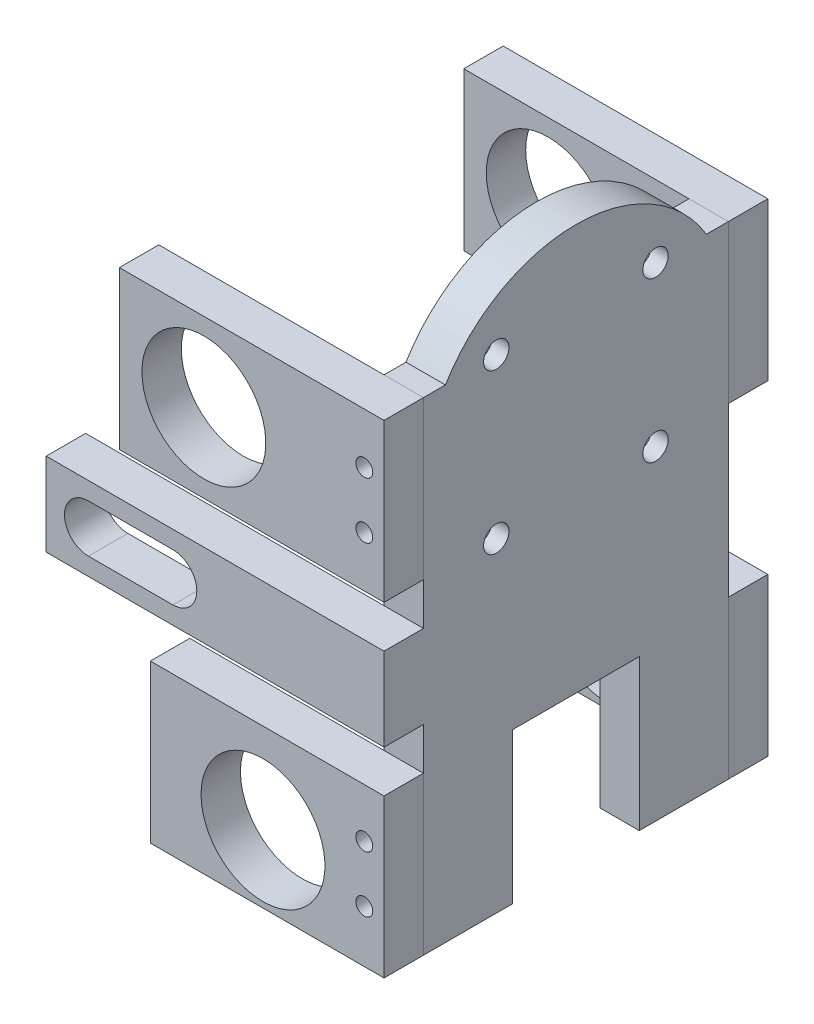
from build123d import *

# Parameters (mm, degrees)
BOSS_EXTRUDE1_DEPTH            = 3.5
BOSS_EXTRUDE1_DEPTH_BACK       = 3.5
BOSS_EXTRUDE2_DEPTH            = 3.5
BOSS_EXTRUDE2_DEPTH_BACK       = 3.5
SKETCH3_W                      = 68.16
SKETCH3_H                      = 28
CBORE_FOR_M4_SHCS1_D           = 4.5
CBORE_FOR_M4_SHCS1_CBORE_D     = 8
CBORE_FOR_M4_SHCS1_CBORE_DEPTH = 4
SKETCH5_W                      = 7
SKETCH5_H                      = 28
BOSS_EXTRUDE4_DEPTH            = 40
SKETCH6_R                      = 11
CUT_EXTRUDE2_DEPTH             = 101.687812569
SKETCH7_W                      = 22.5
SKETCH7_H                      = 15
CUT_EXTRUDE3_DEPTH             = 80.758676017
SKETCH8_W                      = 41.5
SKETCH8_H                      = 28
BOSS_EXTRUDE5_DEPTH            = 7
CUT_EXTRUDE4_DEPTH             = 104.844732654
CUT_EXTRUDE4_DEPTH_BACK        = 104.844732654
SKETCH9_R                      = 11
SKETCH17_W                     = 7
SKETCH17_H                     = 15.83
BOSS_EXTRUDE8_DEPTH            = 11.77
SKETCH13_W                     = 60
SKETCH13_H                     = 14.77
BOSS_EXTRUDE7_DEPTH            = 7
CUT_EXTRUDE5_REACH             = 115.969
SKETCH16_R                     = 1.5
CUT_EXTRUDE6_DEPTH             = 7.5
SPLIT1_START                   = 27.08
SPLIT1_OUTLINE_W               = 41.5
SPLIT1_OUTLINE_H               = 28
SPLIT1_OUTLINE_R               = 11
SPLIT1_OUTLINE_R_2             = 1.5
SPLIT1_DEPTH                   = 7
SPLIT1_2_OUTLINE_W             = 47
SPLIT1_2_OUTLINE_H             = 28
SPLIT1_2_OUTLINE_R             = 1.5
SPLIT1_2_OUTLINE_R_2           = 11
SPLIT1_2_DEPTH                 = 7
SPLIT1_3_OUTLINE_W             = 41.5
SPLIT1_3_OUTLINE_H             = 28
SPLIT1_3_OUTLINE_R             = 11
SPLIT1_3_OUTLINE_R_2           = 1.5
SPLIT1_3_OUTLINE_W_2           = 47
SPLIT1_3_DEPTH                 = 7


# Read off the part's stored shape, not the designer's step: Split1
with BuildPart() as part:
    # Sketch1 → Boss-Extrude1 (new, two sides: drawn at the far end of the back side and taken through both)
    with BuildSketch(Plane(origin=(0, 0, 0), x_dir=(0, 0, -1), z_dir=(1, 0, 0)).offset(-BOSS_EXTRUDE1_DEPTH_BACK)):
        with BuildLine():
            Line((-27.08, 0), (-27.08, -60))
            Line((-27.08, -60), (27.08, -60))
            Line((27.08, -60), (27.08, 0))
            ThreePointArc((27.08, 0), (0, 27.08), (-27.08, 0))
        make_face()
    extrude(amount=BOSS_EXTRUDE1_DEPTH + BOSS_EXTRUDE1_DEPTH_BACK)

    # Sketch3 → Boss-Extrude2 (add, two sides: drawn at the far end of the back side and taken through both)
    with BuildSketch(Plane(origin=(0, 0, 0), x_dir=(0, 0, -1), z_dir=(1, 0, 0)).offset(-BOSS_EXTRUDE2_DEPTH_BACK)):
        Rectangle(SKETCH3_W, SKETCH3_H)
    extrude(amount=BOSS_EXTRUDE2_DEPTH + BOSS_EXTRUDE2_DEPTH_BACK)

    # CBORE for M4 SHCS1 (through all)
    with Locations(Plane(origin=(-3.5, 0, 0), x_dir=(0, 0, -1), z_dir=(-1, 0, 0))):
        with Locations((-14.142135624, -14.142135624), (-14.142135624, 14.142135624), (14.142135624, 14.142135624), (14.142135624, -14.142135624)):
            CounterBoreHole(CBORE_FOR_M4_SHCS1_D / 2, CBORE_FOR_M4_SHCS1_CBORE_D / 2, CBORE_FOR_M4_SHCS1_CBORE_DEPTH)

    # Sketch5 → Boss-Extrude4 (add)
    with BuildSketch(Plane.ZY.offset(3.5)):
        with Locations((-30.58, 0)):
            Rectangle(SKETCH5_W, SKETCH5_H)
        with Locations((30.58, 0)):
            Rectangle(SKETCH5_W, SKETCH5_H)
    extrude(amount=BOSS_EXTRUDE4_DEPTH)

    # Sketch6 → Cut-Extrude2 (cut, through all)
    with BuildSketch(Plane(origin=(0, 0, -34.08), x_dir=(-1, 0, 0), z_dir=(0, 0, -1))):
        with Locations((28.5, 0)):
            Circle(SKETCH6_R)
    extrude(amount=-CUT_EXTRUDE2_DEPTH, mode=Mode.SUBTRACT)

    # Sketch7 → Cut-Extrude3 (cut, through all)
    with BuildSketch(Plane.ZY.offset(3.5)):
        with Locations((0, -52.5)):
            Rectangle(SKETCH7_W, SKETCH7_H)
    extrude(amount=-CUT_EXTRUDE3_DEPTH, mode=Mode.SUBTRACT)

    # Sketch8 → Boss-Extrude5 (add)
    with BuildSketch(Plane.XY.offset(27.08)):
        with Locations((-17.25, -57.77)):
            Rectangle(SKETCH8_W, SKETCH8_H)
    boss_extrude5 = extrude(amount=BOSS_EXTRUDE5_DEPTH)

    # Mirror1: Boss-Extrude5 across plane
    add(boss_extrude5.mirror(Plane.XY))

    # Sketch9 → Cut-Extrude4 (cut, two sides: drawn at the far end of the back side and taken through both)
    with BuildSketch(Plane(origin=(0, 0, 27.08), x_dir=(-1, 0, 0), z_dir=(0, 0, -1)).offset(-CUT_EXTRUDE4_DEPTH_BACK)):
        with Locations((18, -59.77)):
            Circle(SKETCH9_R)
    extrude(amount=CUT_EXTRUDE4_DEPTH + CUT_EXTRUDE4_DEPTH_BACK, mode=Mode.SUBTRACT)

    # Sketch17 → Boss-Extrude8 (add)
    with BuildSketch(Plane.XZ.offset(60)):
        with Locations((0, 19.165)):
            Rectangle(SKETCH17_W, SKETCH17_H)
        with Locations((0, -19.165)):
            Rectangle(SKETCH17_W, SKETCH17_H)
    extrude(amount=BOSS_EXTRUDE8_DEPTH)

    # Sketch13 → Boss-Extrude7 (add)
    with BuildSketch(Plane.XY.offset(27.08)):
        with Locations((-26.5, -28.885)):
            Rectangle(SKETCH13_W, SKETCH13_H)
    extrude(amount=BOSS_EXTRUDE7_DEPTH)

    # Sketch15 → Cut-Extrude5 (cut, up to next)
    with BuildSketch(Plane.XY.offset(34.08), mode=Mode.PRIVATE) as cut_extrude5_sk1:
        with BuildLine():
            Line((-34, -33.135), (-49, -33.135))
            ThreePointArc((-49, -33.135), (-53.25, -28.885), (-49, -24.635))
            Line((-49, -24.635), (-34, -24.635))
            ThreePointArc((-34, -24.635), (-29.75, -28.885), (-34, -33.135))
        make_face()
    cut_extrude5_tool1 = extrude(cut_extrude5_sk1.sketch, amount=-CUT_EXTRUDE5_REACH, mode=Mode.PRIVATE) & part.part
    add(cut_extrude5_tool1.solids().sort_by_distance((-41.5, -28.885, 34.08))[0], mode=Mode.SUBTRACT)

    # Sketch16 → Cut-Extrude6 (cut, symmetric)
    with BuildSketch(Plane.XY.offset(34.08)):
        with Locations((0, 5)):
            Circle(SKETCH16_R)
        with Locations((0, -5)):
            Circle(SKETCH16_R)
        with Locations((0, -52.5)):
            Circle(SKETCH16_R)
        with Locations((0, -62.5)):
            Circle(SKETCH16_R)
    cut_extrude6 = extrude(amount=CUT_EXTRUDE6_DEPTH, both=True, mode=Mode.SUBTRACT)

    # Mirror3: Cut-Extrude6 across plane
    add(cut_extrude6.mirror(Plane.XY), mode=Mode.SUBTRACT)

    # Split1 3 outline → Split1 3 (cut)
    # profile 1 of 2: a face of its own
    with BuildSketch(Plane.XY.offset(SPLIT1_START)):
        with Locations((-17.25, -57.77)):
            Rectangle(SPLIT1_3_OUTLINE_W, SPLIT1_3_OUTLINE_H)
        with Locations((-18, -59.77)):
            Circle(SPLIT1_3_OUTLINE_R, mode=Mode.SUBTRACT)
        with Locations((0, -62.5)):
            Circle(SPLIT1_3_OUTLINE_R_2, mode=Mode.SUBTRACT)
        with Locations((0, -52.5)):
            Circle(SPLIT1_3_OUTLINE_R_2, mode=Mode.SUBTRACT)
    # profile 2 of 2: a face of its own
    with BuildSketch(Plane.XY.offset(SPLIT1_START)):
        with Locations((-20, 0)):
            Rectangle(SPLIT1_3_OUTLINE_W_2, SPLIT1_3_OUTLINE_H)
        with Locations((-28.5, 0)):
            Circle(SPLIT1_3_OUTLINE_R, mode=Mode.SUBTRACT)
        with Locations((0, -5)):
            Circle(SPLIT1_3_OUTLINE_R_2, mode=Mode.SUBTRACT)
        with Locations((0, 5)):
            Circle(SPLIT1_3_OUTLINE_R_2, mode=Mode.SUBTRACT)
    extrude(amount=SPLIT1_3_DEPTH, mode=Mode.SUBTRACT)


with BuildPart() as body_2:
    # Split1 outline → Split1 (new body)
    with BuildSketch(Plane.XY.offset(SPLIT1_START)):
        with Locations((-17.25, -57.77)):
            Rectangle(SPLIT1_OUTLINE_W, SPLIT1_OUTLINE_H)
        with Locations((-18, -59.77)):
            Circle(SPLIT1_OUTLINE_R, mode=Mode.SUBTRACT)
        with Locations((0, -62.5)):
            Circle(SPLIT1_OUTLINE_R_2, mode=Mode.SUBTRACT)
        with Locations((0, -52.5)):
            Circle(SPLIT1_OUTLINE_R_2, mode=Mode.SUBTRACT)
    extrude(amount=SPLIT1_DEPTH)


with BuildPart() as body_3:
    # Split1 2 outline → Split1 2 (new body)
    with BuildSketch(Plane.XY.offset(SPLIT1_START)):
        with Locations((-20, 0)):
            Rectangle(SPLIT1_2_OUTLINE_W, SPLIT1_2_OUTLINE_H)
        with Locations((0, -5)):
            Circle(SPLIT1_2_OUTLINE_R, mode=Mode.SUBTRACT)
        with Locations((-28.5, 0)):
            Circle(SPLIT1_2_OUTLINE_R_2, mode=Mode.SUBTRACT)
        with Locations((0, 5)):
            Circle(SPLIT1_2_OUTLINE_R, mode=Mode.SUBTRACT)
    extrude(amount=SPLIT1_2_DEPTH)


with BuildPart() as body_4:
    # Split2: the piece on the far side of the plane
    add(part.part)
    split(bisect_by=Plane(origin=(0, 0, -27.08), x_dir=(0, -1, 0), z_dir=(0, 0, -1)), keep=Keep.BOTTOM)


with BuildPart() as part_1:
    add(part.part)

    # Split2
    split(bisect_by=Plane(origin=(0, 0, -27.08), x_dir=(0, -1, 0), z_dir=(0, 0, -1)), keep=Keep.TOP)


solid = Compound([body_2.part, body_3.part, body_4.part, part_1.part])
